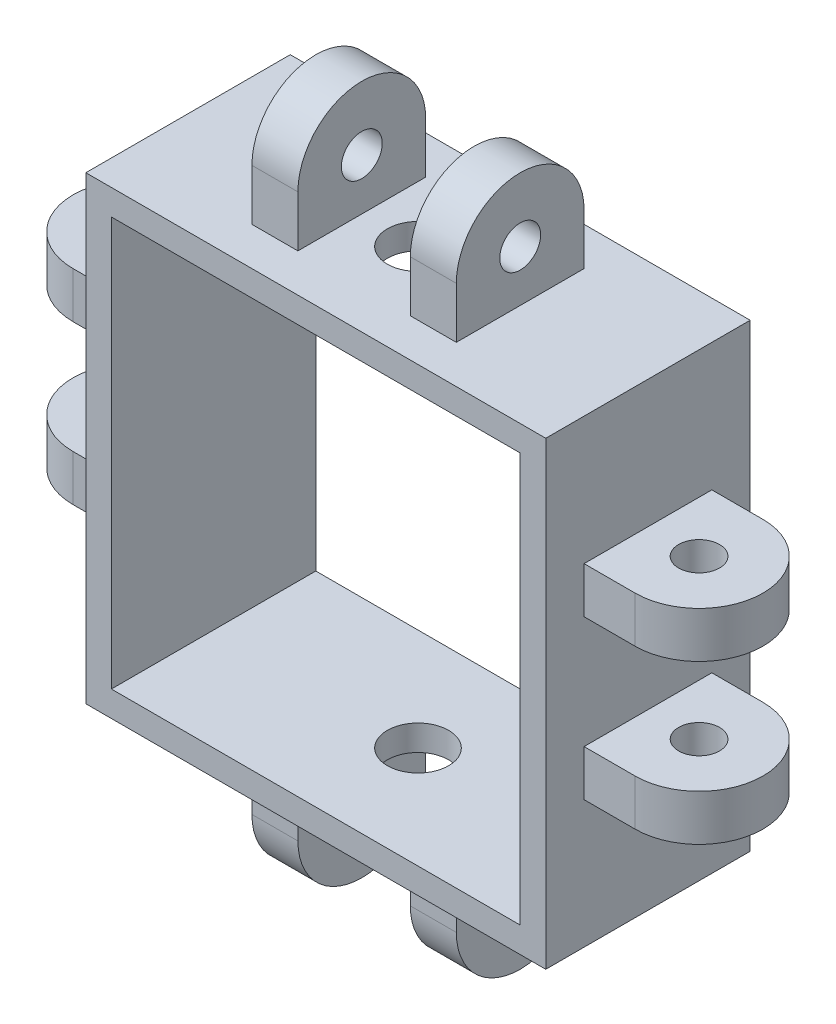
from build123d import *

# Parameters (mm, degrees)
SKETCH_1_W               = 90
SKETCH_1_H               = 90
SKETCH_1_W_2             = 80
SKETCH_1_H_2             = 80
EXTRUDE_1_DEPTH          = 40
SKETCH_3_R               = 6
CUT_EXTRUDE_2_DEPTH      = 109.282039139
SKETCH_4_R               = 4
EXTRUDE_2_DEPTH          = 20
SKETCH_5_W               = 22
SKETCH_5_H               = 30
CUT_EXTRUDE_3_DEPTH      = 88.392791465
PATTERN_CIRCULAR_3_COUNT = 4


with BuildPart() as part:
    # 草图1 → 凸台-拉伸1 (new body)
    with BuildSketch(Plane.XY):
        Rectangle(SKETCH_1_W, SKETCH_1_H)
        Rectangle(SKETCH_1_W_2, SKETCH_1_H_2, mode=Mode.SUBTRACT)
    extrude(amount=EXTRUDE_1_DEPTH)

    # 草图3 → 切除-拉伸2 (cut, through all)
    with BuildSketch(Plane(origin=(0, 45, 0), x_dir=(1, 0, 0), z_dir=(0, 1, 0))):
        with Locations((0, -20)):
            Circle(SKETCH_3_R)
    extrude(amount=-CUT_EXTRUDE_2_DEPTH, mode=Mode.SUBTRACT)

    # 草图4 → 凸台-拉伸2 (add, symmetric)
    with BuildSketch(Plane(origin=(0, -1.997656421, 74.265247584), x_dir=(0, 0, -1), z_dir=(1, 0, 0))):
        with BuildLine():
            Line((41.765247584, -43.002343579), (41.765247584, -53.002343579))
            ThreePointArc((41.765247584, -53.002343579), (54.265247584, -65.502343579), (66.765247584, -53.002343579))
            Line((66.765247584, -53.002343579), (66.765247584, -43.002343579))
            Line((66.765247584, -43.002343579), (41.765247584, -43.002343579))
        make_face()
        with Locations((54.265247584, -53.002343579)):
            Circle(SKETCH_4_R, mode=Mode.SUBTRACT)
    extrude_2 = extrude(amount=EXTRUDE_2_DEPTH, both=True)

    # 草图5 → 切除-拉伸3 (cut, through all)
    with BuildSketch(Plane(origin=(0, 0, 7.5), x_dir=(-1, 0, 0), z_dir=(0, 0, -1))):
        with Locations((0, -60)):
            Rectangle(SKETCH_5_W, SKETCH_5_H)
    cut_extrude_3 = extrude(amount=-CUT_EXTRUDE_3_DEPTH, mode=Mode.SUBTRACT)

    # 阵列(圆周)3: 凸台-拉伸2, 切除-拉伸3 ×4 about axis
    pattern_circular_3_axis = Axis((0, 0, 42), (0, 0, -1))
    add([extrude_2.rotate(pattern_circular_3_axis, i * 360 / PATTERN_CIRCULAR_3_COUNT) for i in range(1, PATTERN_CIRCULAR_3_COUNT)])
    add([cut_extrude_3.rotate(pattern_circular_3_axis, i * 360 / PATTERN_CIRCULAR_3_COUNT) for i in range(1, PATTERN_CIRCULAR_3_COUNT)], mode=Mode.SUBTRACT)


solid = part.part
